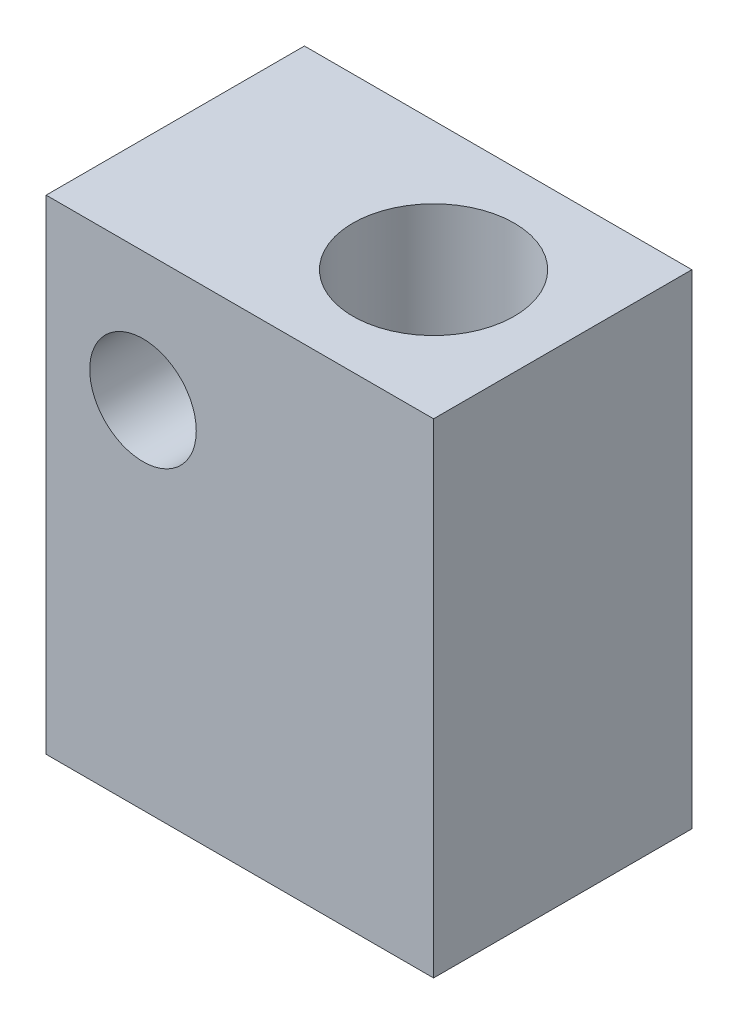
from build123d import *

# Parameters (mm, degrees)
SKETCH1_W           = 12
SKETCH1_H           = 15
SKETCH1_R           = 1.65
BOSS_EXTRUDE1_DEPTH = 8
SKETCH2_R           = 2.5
CUT_EXTRUDE1_DEPTH  = 20.235384062
SKETCH3_R           = 1.5
CUT_EXTRUDE2_DEPTH  = 8
CHAMFER1_SIZE       = 1.25
CHAMFER1_SIZE2      = 0.891616335


with BuildPart() as part:
    # Sketch1 → Boss-Extrude1 (new body)
    with BuildSketch(Plane.XY):
        with Locations((3, -3.5)):
            Rectangle(SKETCH1_W, SKETCH1_H)
        Circle(SKETCH1_R, mode=Mode.SUBTRACT)
    extrude(amount=BOSS_EXTRUDE1_DEPTH)

    # Sketch2 → Cut-Extrude1 (cut, through all)
    with BuildSketch(Plane.XZ.offset(11)):
        with Locations((5, 4)):
            Circle(SKETCH2_R)
    extrude(amount=-CUT_EXTRUDE1_DEPTH, mode=Mode.SUBTRACT)

    # Sketch3 → Cut-Extrude2 (cut)
    with BuildSketch(Plane.XZ.offset(11)):
        with Locations((0, 2.5)):
            Circle(SKETCH3_R)
    extrude(amount=-CUT_EXTRUDE2_DEPTH, mode=Mode.SUBTRACT)

    # Chamfer1
    chamfer1_edges = [part.edges().sort_by_distance(p)[0] for p in [
        (-1.5, -3, 2.5),
    ]]
    chamfer1_side = [part.faces().sort_by_distance(p)[0] for p in [
        (-1.5, -7, 2.5),
    ]]
    chamfer(chamfer1_edges, length=CHAMFER1_SIZE, length2=CHAMFER1_SIZE2, reference=chamfer1_side[0])


solid = part.part
